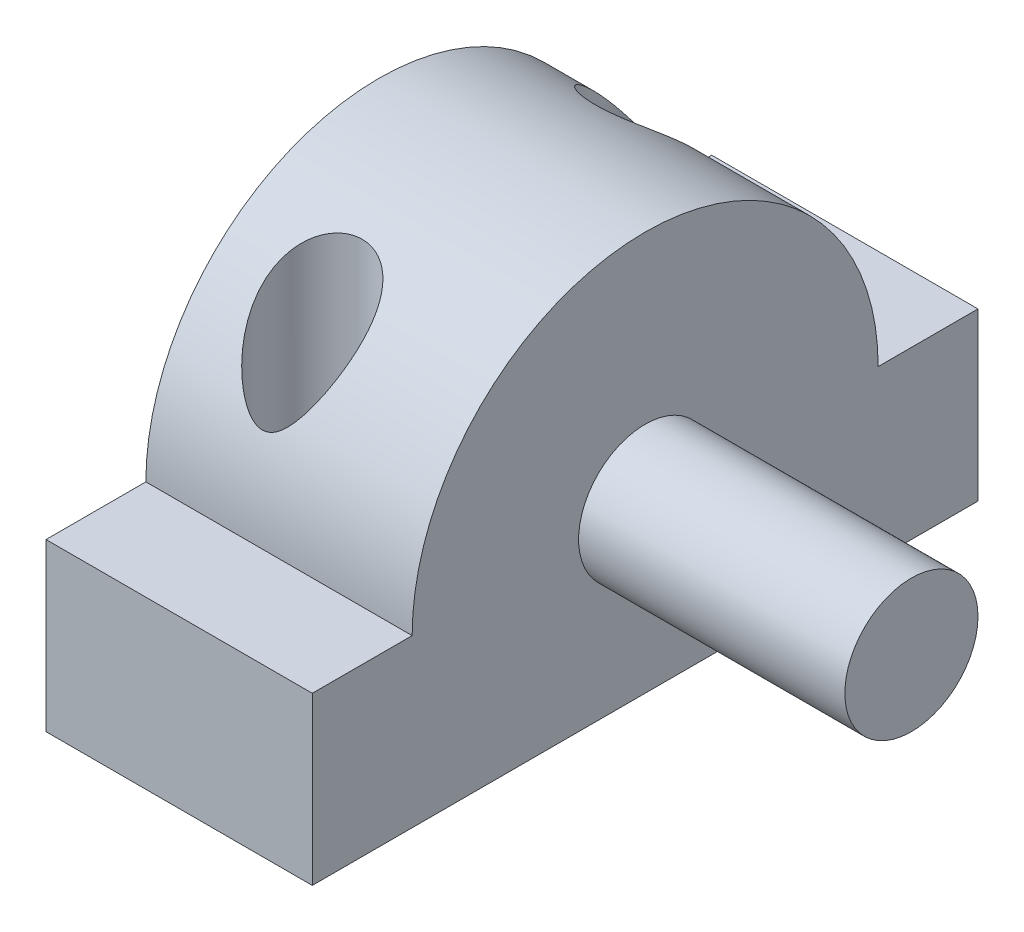
from build123d import *

# Parameters (mm, degrees)
BOSS_EXTRUDE1_DEPTH = 8
SKETCH2_R           = 2
BOSS_EXTRUDE2_DEPTH = 8
SKETCH3_R           = 1.5
CUT_EXTRUDE1_DEPTH  = 15


with BuildPart() as part:
    # Sketch1 → Boss-Extrude1 (new body)
    with BuildSketch(Plane(origin=(0, 0, 0), x_dir=(0, 0, -1), z_dir=(1, 0, 0))):
        with BuildLine():
            Line((17, 0), (20, 0))
            Line((20, 0), (20, -5))
            Line((20, -5), (0, -5))
            Line((0, -5), (0, 0))
            Line((0, 0), (3, 0))
            ThreePointArc((3, 0), (10, 7), (17, 0))
        make_face()
    extrude(amount=BOSS_EXTRUDE1_DEPTH)

    # Sketch2 → Boss-Extrude2 (add)
    with BuildSketch(Plane(origin=(8, 0, 0), x_dir=(0, 0, -1), z_dir=(1, 0, 0))):
        with Locations((10, 0)):
            Circle(SKETCH2_R)
    extrude(amount=BOSS_EXTRUDE2_DEPTH)

    # Sketch3 → Cut-Extrude1 (cut)
    with BuildSketch(Plane.XZ.offset(5)):
        with Locations((3, -5)):
            Circle(SKETCH3_R)
        with Locations((3, -15)):
            Circle(SKETCH3_R)
    extrude(amount=-CUT_EXTRUDE1_DEPTH, mode=Mode.SUBTRACT)


solid = part.part
